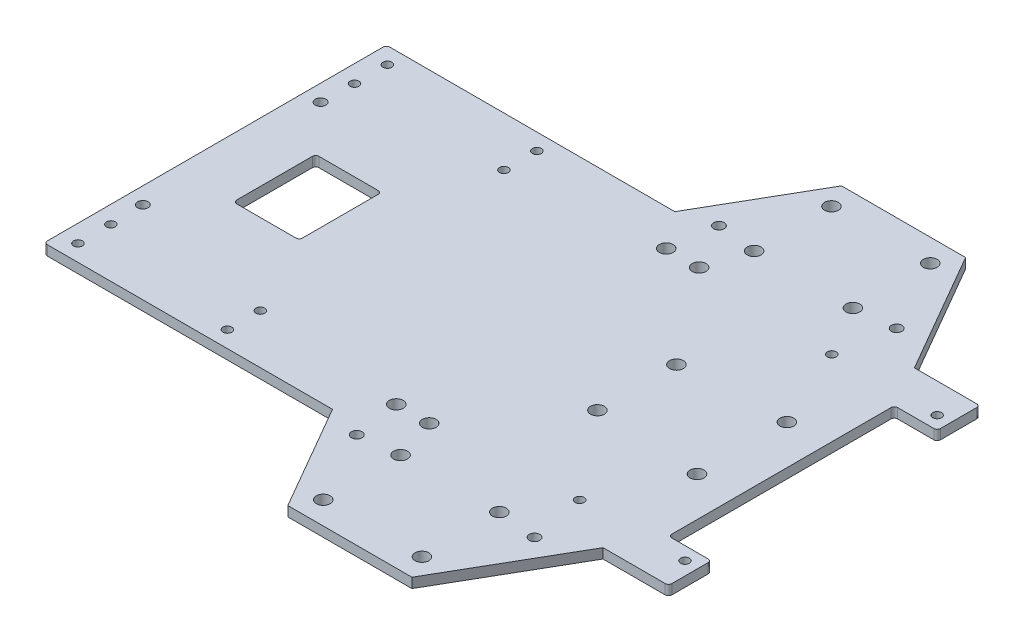
from build123d import *

# Parameters (mm, degrees)
BOSS_EXTRUDE1_DEPTH                 = 3
SKETCH2_R                           = 1.35
MOTOR_CLEVIS_HOLES_DEPTH            = 204.240768548
SKETCH3_R                           = 1.35
SERVO_CLEVIS_HOLES_DEPTH            = 204.240768548
SKETCH4_R                           = 2.1
BUCKET_HOLE_DEPTH                   = 204.240768548
SKETCH5_R                           = 2.1
CASTER_HOLES_DEPTH                  = 204.240768548
SKETCH6_W                           = 13
SKETCH6_H                           = 68.6
FRONT_NOTCH_DEPTH                   = 204.240768548
FILLET2_R                           = 1
SKETCH9_R                           = 2.1
COLOR_SENSOR_BRACKET_HOLES_DEPTH    = 204.240768548
SKETCH10_W                          = 20
SKETCH10_H                          = 25
MOTOR_ROUTING_POCKET_DEPTH          = 204.240768548
FILLET3_R                           = 1
SKETCH11_R                          = 1.6
PLATE_STANDOFF_HOLES_DEPTH          = 204.240768548
SKETCH12_R                          = 2.1
ULTRASONIC_SENSOR_MOUNT_HOLES_DEPTH = 204.240768548


with BuildPart() as part:
    # Sketch1 → Boss-Extrude1 (new body)
    with BuildSketch(Plane(origin=(0, 0, 0), x_dir=(1, 0, 0), z_dir=(0, 1, 0))):
        Polygon((0, 52), (0, -52), (87.617056359, -52), (106.15, -84.1), (143.85, -84.1), (165.096489906, -47.3), (185, -47.3), (185, 47.3), (165.096489906, 47.3), (143.85, 84.1), (106.15, 84.1), (87.617056359, 52), align=None)
    extrude(amount=BOSS_EXTRUDE1_DEPTH)

    # Sketch2 → Motor Clevis Holes (cut, through all)
    with BuildSketch(Plane(origin=(0, 3, 0), x_dir=(1, 0, 0), z_dir=(0, 1, 0))):
        with Locations((5.3, 47)):
            Circle(SKETCH2_R)
        with Locations((5.3, 37)):
            Circle(SKETCH2_R)
        with Locations((50.7, 47)):
            Circle(SKETCH2_R)
        with Locations((50.7, 37)):
            Circle(SKETCH2_R)
    motor_clevis_holes = extrude(amount=-MOTOR_CLEVIS_HOLES_DEPTH, mode=Mode.SUBTRACT)

    # Motor Clevis Holes Mirror: Motor Clevis Holes across plane
    add(motor_clevis_holes.mirror(Plane.XY), mode=Mode.SUBTRACT)

    # Sketch3 → Servo Clevis Holes (cut, through all)
    with BuildSketch(Plane(origin=(0, 3, 0), x_dir=(1, 0, 0), z_dir=(0, 1, 0))):
        with Locations((181, -38.3)):
            Circle(SKETCH3_R)
        with Locations((149, -38.3)):
            Circle(SKETCH3_R)
    servo_clevis_holes = extrude(amount=-SERVO_CLEVIS_HOLES_DEPTH, mode=Mode.SUBTRACT)

    # Servo Clevis Holes Mirror: Servo Clevis Holes across plane
    add(servo_clevis_holes.mirror(Plane.XY), mode=Mode.SUBTRACT)

    # Sketch4 → Bucket Hole (cut, through all)
    with BuildSketch(Plane(origin=(0, 3, 0), x_dir=(1, 0, 0), z_dir=(0, 1, 0))):
        with Locations((128.1, -12)):
            Circle(SKETCH4_R)
    bucket_hole = extrude(amount=-BUCKET_HOLE_DEPTH, mode=Mode.SUBTRACT)

    # Bucket Hole Mirror: Bucket Hole across plane
    add(bucket_hole.mirror(Plane.XY), mode=Mode.SUBTRACT)

    # Sketch5 → Caster Holes (cut, through all)
    with BuildSketch(Plane(origin=(0, 3, 0), x_dir=(1, 0, 0), z_dir=(0, 1, 0))):
        with Locations((110, -53.7)):
            Circle(SKETCH5_R)
        with Locations((110, -77.2)):
            Circle(SKETCH5_R)
        with Locations((140, -77.2)):
            Circle(SKETCH5_R)
        with Locations((140, -53.7)):
            Circle(SKETCH5_R)
    caster_holes = extrude(amount=-CASTER_HOLES_DEPTH, mode=Mode.SUBTRACT)

    # Caster Holes Mirror: Caster Holes across plane
    add(caster_holes.mirror(Plane.XY), mode=Mode.SUBTRACT)

    # Sketch6 → Front Notch (cut, through all)
    with BuildSketch(Plane(origin=(0, 3, 0), x_dir=(1, 0, 0), z_dir=(0, 1, 0))):
        with Locations((178.5, 0)):
            Rectangle(SKETCH6_W, SKETCH6_H)
    extrude(amount=-FRONT_NOTCH_DEPTH, mode=Mode.SUBTRACT)

    # Fillet2
    fillet2_edges = [part.edges().sort_by_distance(p)[0] for p in [
        (185, 1.5, 47.3),
        (185, 1.5, 34.3),
        (172, 1.5, 34.3),
        (172, 1.5, -34.3),
        (185, 1.5, -34.3),
        (185, 1.5, -47.3),
        (0, 1.5, -52),
        (0, 1.5, 52),
    ]]
    fillet(fillet2_edges, radius=FILLET2_R)

    # Sketch9 → Color Sensor Bracket Holes (cut, through all)
    with BuildSketch(Plane(origin=(0, 3, 0), x_dir=(1, 0, 0), z_dir=(0, 1, 0))):
        with Locations((106, 41)):
            Circle(SKETCH9_R)
        with Locations((96, 41)):
            Circle(SKETCH9_R)
        with Locations((106, -41)):
            Circle(SKETCH9_R)
        with Locations((96, -41)):
            Circle(SKETCH9_R)
    extrude(amount=-COLOR_SENSOR_BRACKET_HOLES_DEPTH, mode=Mode.SUBTRACT)

    # Sketch10 → Motor Routing Pocket (cut, through all)
    with BuildSketch(Plane(origin=(0, 3, 0), x_dir=(1, 0, 0), z_dir=(0, 1, 0))):
        with Locations((28, 0)):
            Rectangle(SKETCH10_W, SKETCH10_H)
    extrude(amount=-MOTOR_ROUTING_POCKET_DEPTH, mode=Mode.SUBTRACT)

    # Fillet3
    fillet3_edges = [part.edges().sort_by_distance(p)[0] for p in [
        (18, 1.5, 12.5),
        (38, 1.5, 12.5),
        (38, 1.5, -12.5),
        (18, 1.5, -12.5),
    ]]
    fillet(fillet3_edges, radius=FILLET3_R)

    # Sketch11 → Plate Standoff Holes (cut, through all)
    with BuildSketch(Plane(origin=(0, 3, 0), x_dir=(1, 0, 0), z_dir=(0, 1, 0))):
        with Locations((5, 27)):
            Circle(SKETCH11_R)
        with Locations((5, -27)):
            Circle(SKETCH11_R)
        with Locations((98, -55)):
            Circle(SKETCH11_R)
        with Locations((98, 55)):
            Circle(SKETCH11_R)
        with Locations((152, -55)):
            Circle(SKETCH11_R)
        with Locations((152, 55)):
            Circle(SKETCH11_R)
    extrude(amount=-PLATE_STANDOFF_HOLES_DEPTH, mode=Mode.SUBTRACT)

    # Sketch12 → Ultrasonic Sensor Mount Holes (cut, through all)
    with BuildSketch(Plane(origin=(0, 3, 0), x_dir=(1, 0, 0), z_dir=(0, 1, 0))):
        with Locations((160, 13.65)):
            Circle(SKETCH12_R)
        with Locations((160, -13.65)):
            Circle(SKETCH12_R)
    extrude(amount=-ULTRASONIC_SENSOR_MOUNT_HOLES_DEPTH, mode=Mode.SUBTRACT)


solid = part.part
